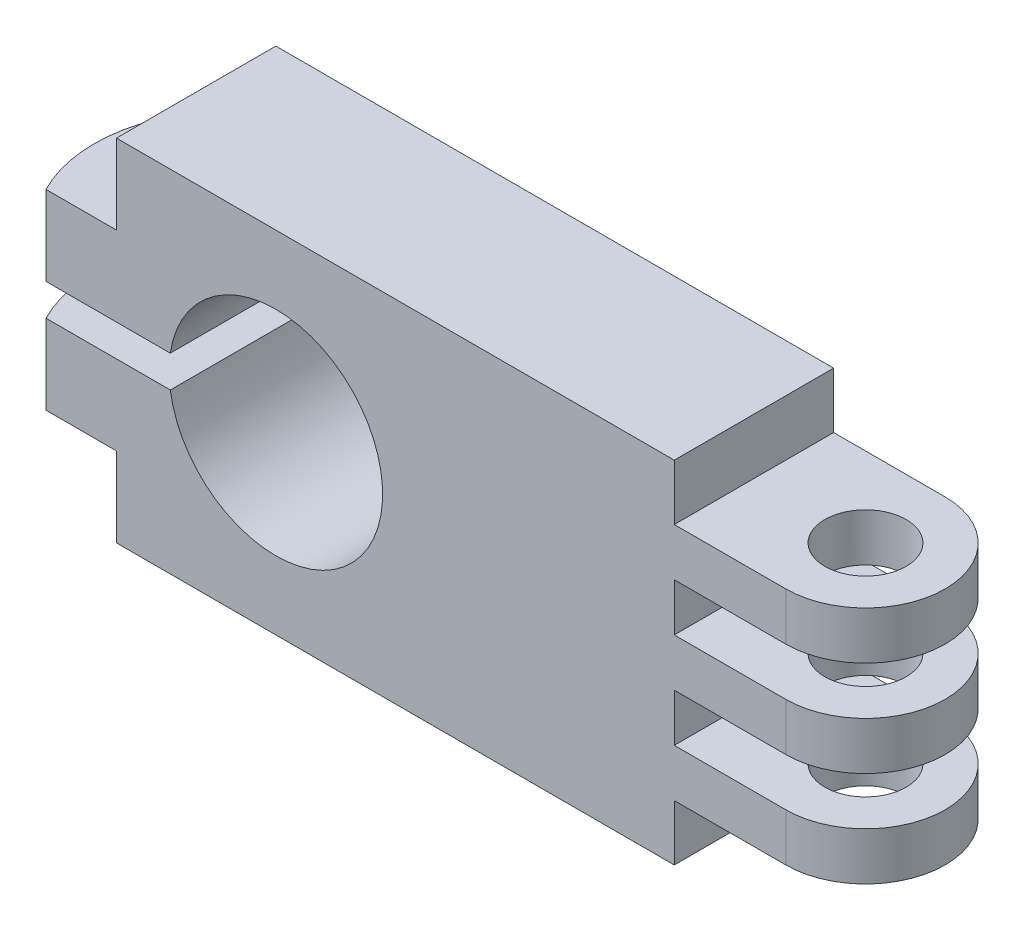
from build123d import *

# Parameters (mm, degrees)
EXTRUDE_1_DEPTH     = 10
SKETCH_2_R          = 2.55
CUT_EXTRUDE_1_DEPTH = 19
CUT_EXTRUDE_2_DEPTH = 19
SKETCH_5_W          = 10
SKETCH_5_H          = 2
CUT_EXTRUDE_4_DEPTH = 19
SKETCH_6_R          = 6.7
CUT_EXTRUDE_5_DEPTH = 19
CUT_EXTRUDE_6_DEPTH = 19
SKETCH_8_R          = 1
CUT_EXTRUDE_7_DEPTH = 18


with BuildPart() as part:
    # 草图1 → 凸台-拉伸1 (new body)
    with BuildSketch(Plane.XY):
        Polygon((0, 0), (35, 0), (35, -3.5), (47, -3.5), (47, -6.5), (35, -6.5), (35, -9.5), (47, -9.5), (47, -12.5), (35, -12.5), (35, -15.5), (47, -15.5), (47, -18.5), (35, -18.5), (35, -22), (0, -22), (0, -17), (-10, -17), (-10, -12), (0, -12), (0, -10), (-10, -10), (-10, -5), (0, -5), align=None)
    extrude(amount=EXTRUDE_1_DEPTH)

    # 草图2 → 切除-拉伸1 (cut)
    with BuildSketch(Plane(origin=(0, -3.5, 0), x_dir=(1, 0, 0), z_dir=(0, 1, 0))):
        with Locations((42, -5)):
            Circle(SKETCH_2_R)
    extrude(amount=-CUT_EXTRUDE_1_DEPTH, mode=Mode.SUBTRACT)

    # 草图3 → 切除-拉伸2 (cut)
    with BuildSketch(Plane(origin=(0, -3.5, 0), x_dir=(1, 0, 0), z_dir=(0, 1, 0))):
        with BuildLine():
            Line((42, 0), (35, 0))
            Line((35, 0), (35, 1.362905895))
            Line((35, 1.362905895), (53.328864927, 1.362905895))
            Line((53.328864927, 1.362905895), (53.328864927, -13.813237877))
            Line((53.328864927, -13.813237877), (35, -13.813237877))
            Line((35, -13.813237877), (35, -10))
            Line((35, -10), (42, -10))
            ThreePointArc((42, -10), (47, -5), (42, 0))
        make_face()
    extrude(amount=-CUT_EXTRUDE_2_DEPTH, mode=Mode.SUBTRACT)

    # 草图5 → 切除-拉伸4 (cut)
    with BuildSketch(Plane.XY.offset(10)):
        with Locations((5, -11)):
            Rectangle(SKETCH_5_W, SKETCH_5_H)
    extrude(amount=-CUT_EXTRUDE_4_DEPTH, mode=Mode.SUBTRACT)

    # 草图6 → 切除-拉伸5 (cut)
    with BuildSketch(Plane.XY.offset(10)):
        with Locations((10, -11)):
            Circle(SKETCH_6_R)
    extrude(amount=-CUT_EXTRUDE_5_DEPTH, mode=Mode.SUBTRACT)

    # 草图7 → 切除-拉伸6 (cut)
    with BuildSketch(Plane(origin=(0, -5, 0), x_dir=(1, 0, 0), z_dir=(0, 1, 0))):
        with BuildLine():
            Line((-4.422847497, -10), (-4.422847497, -16.245470045))
            Line((-4.422847497, -16.245470045), (-15.241663488, -16.245470045))
            Line((-15.241663488, -16.245470045), (-15.241663488, 3.326156632))
            Line((-15.241663488, 3.326156632), (-3, 3.326156632))
            Line((-3, 3.326156632), (-3, 0))
            ThreePointArc((-3, 0), (-5.308519262, -4.772757665), (-4.422847497, -10))
        make_face()
    extrude(amount=-CUT_EXTRUDE_6_DEPTH, mode=Mode.SUBTRACT)

    # 草图8 → 切除-拉伸7 (cut)
    with BuildSketch(Plane(origin=(0, -5, 0), x_dir=(1, 0, 0), z_dir=(0, 1, 0))):
        with Locations((-2.5, -6)):
            Circle(SKETCH_8_R)
    extrude(amount=-CUT_EXTRUDE_7_DEPTH, mode=Mode.SUBTRACT)


solid = part.part
